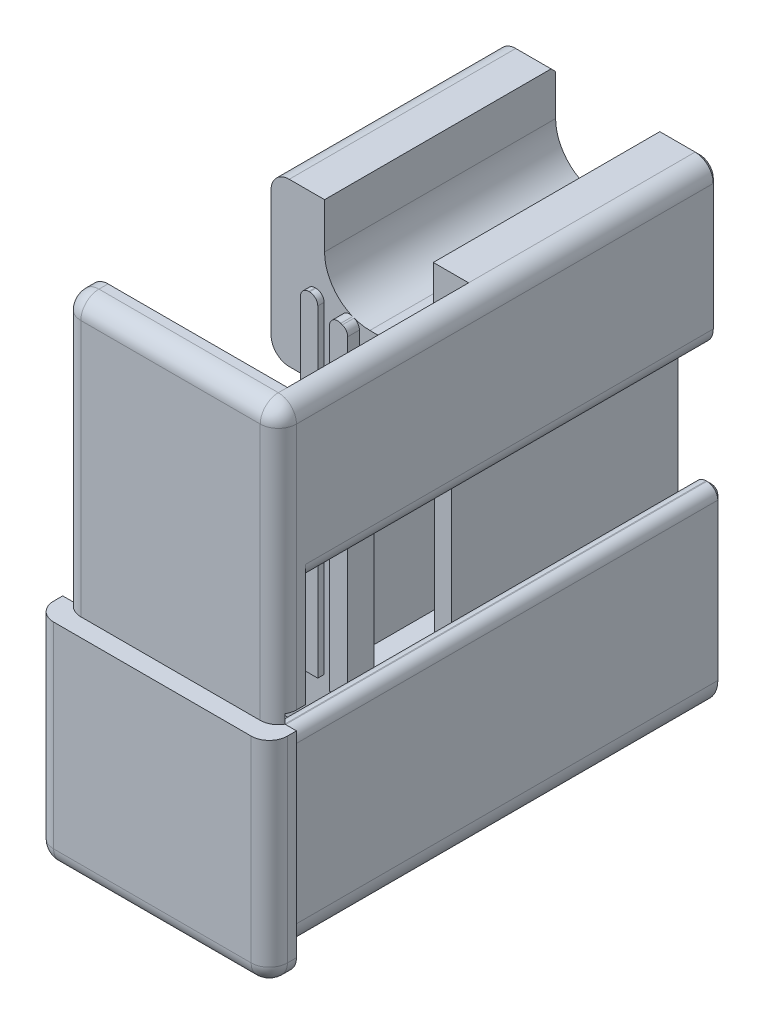
from build123d import *

# Parameters (mm, degrees)
BOSS_EXTRUDE1_DEPTH  = 47.5
CHAMFER1_SIZE        = 3
CUT_EXTRUDE1_DEPTH   = 25.5
BOSS_EXTRUDE3_DEPTH  = 47.5
CUT_EXTRUDE3_DEPTH   = 4.3
SKETCH9_R            = 0.7500000000000007
SKETCH9_R_2          = 0.7499999999999999
CUT_EXTRUDE4_DEPTH   = 6
SKETCH10_R           = 2.740000000000001
CUT_EXTRUDE5_DEPTH   = 4.3
FILLET3_R            = 3
SKETCH12_W           = 12.3
SKETCH12_H           = 11.91
BOSS_EXTRUDE4_DEPTH  = 22
CUT_EXTRUDE15_REACH  = 60.816
BOSS_EXTRUDE12_DEPTH = 3
BOSS_EXTRUDE14_DEPTH = 1.6
BOSS_EXTRUDE17_DEPTH = 17.91
CUT_EXTRUDE16_DEPTH  = 68.03823983369492
SKETCH46_W           = 12.300000000000002
SKETCH46_H           = 4.5
CUT_EXTRUDE18_DEPTH  = 64.86169117710554
SKETCH47_R           = 2.7499999999999996
CUT_EXTRUDE19_DEPTH  = 4.3
SKETCH48_W           = 5.750000000000001
SKETCH48_H           = 17.910000000000004
BOSS_EXTRUDE18_DEPTH = 47.5
BOSS_EXTRUDE19_DEPTH = 1.3
BOSS_EXTRUDE20_DEPTH = 2
SKETCH51_W           = 3.000000000000007
SKETCH51_H           = 29.32
BOSS_EXTRUDE21_DEPTH = 1
SKETCH52_W           = 1.9999999999999973
SKETCH52_H           = 1.9973883587117314
BOSS_EXTRUDE22_DEPTH = 33.59
SKETCH53_W           = 1.4267044630125962
SKETCH53_H           = 3.5699996885908405
CUT_EXTRUDE20_DEPTH  = 76.05104929313114
SKETCH54_W           = 0.49999999999999645
SKETCH54_H           = 3.000000000000007
BOSS_EXTRUDE23_DEPTH = 29.32
BOSS_EXTRUDE24_DEPTH = 54
CUT_EXTRUDE21_DEPTH  = 51.5
SKETCH60_W           = 21.8
SKETCH60_H           = 29.320000000000004
BOSS_EXTRUDE27_DEPTH = 2
CUT_EXTRUDE22_DEPTH  = 5
FILLET6_START        = -1
FILLET6_DEPTH        = 52
FILLET6_START_2      = 45.5
FILLET6_2_DEPTH      = 5.5
FILLET7_R            = 2
CHAMFER2_SIZE        = 0.5
BOSS_EXTRUDE28_DEPTH = 0.7
FILLET9_R            = 0.9
BOSS_EXTRUDE29_DEPTH = 33.59
FILLET10_R           = 0.9
CUT_EXTRUDE23_REACH  = 72.305
FILLET11_R           = 2
SKETCH68_W           = 12
SKETCH68_H           = 10.370358528616812
CUT_EXTRUDE24_DEPTH  = 35
FILLET12_R           = 5
FILLET13_R           = 0.9


with BuildPart() as part:
    # Sketch2 → Boss-Extrude1 (new body)
    with BuildSketch(Plane.XY):
        with BuildLine():
            Line((-9.899999999999999, 10.14), (-9.9, 8.34))
            Line((-9.9, 8.34), (9.899999999999997, 8.34))
            Line((9.899999999999997, 8.34), (9.899999999999997, 10.14))
            ThreePointArc((9.899999999999997, 10.14), (10.25147186257614, 10.988528137423858), (11.099999999999998, 11.340000000000002))
            Line((11.099999999999998, 11.340000000000002), (11.2, 11.340000000000002))
            ThreePointArc((11.2, 11.340000000000002), (12.048528137423856, 10.988528137423858), (12.4, 10.14))
            Line((12.4, 10.14), (12.400000000000004, -11.339999999999998))
            Line((12.400000000000004, -11.339999999999998), (-12.399999999999997, -11.339999999999998))
            Line((-12.399999999999997, -11.339999999999998), (-12.399999999999999, 10.140000000000002))
            ThreePointArc((-12.399999999999999, 10.140000000000002), (-12.048528137423855, 10.98852813742386), (-11.199999999999998, 11.340000000000003))
            Line((-11.199999999999998, 11.340000000000003), (-11.099999999999998, 11.340000000000002))
            ThreePointArc((-11.099999999999998, 11.340000000000002), (-10.25147186257614, 10.988528137423858), (-9.899999999999999, 10.14))
        make_face()
    extrude(amount=BOSS_EXTRUDE1_DEPTH)

    # Chamfer1
    chamfer1_edges = [part.edges().sort_by_distance(p)[0] for p in [
        (12.400000000000004, -11.339999999999998, 23.75),
        (-12.399999999999997, -11.339999999999998, 23.75),
    ]]
    chamfer(chamfer1_edges, length=CHAMFER1_SIZE)

    # Sketch3 → Cut-Extrude1 (cut)
    with BuildSketch(Plane(origin=(0, 0, 0), x_dir=(-1, 0, 0), z_dir=(0, 0, -1))):
        with BuildLine():
            Line((6.15, 20.249999999999996), (-6.15, 20.249999999999996))
            Line((-6.15, 20.249999999999996), (-6.149999999999999, 8.34))
            Line((-6.15, 8.34), (-1.6326971550167642, 8.34))
            ThreePointArc((-1.6326971550167664, 8.340000000000014), (1.3509e-13, 8.57), (1.6326971550170248, 8.339999999999941))
            Line((1.6326971550170342, 8.34), (6.150000000000001, 8.34))
            Line((6.150000000000001, 8.34), (6.1499999999999995, 20.249999999999996))
        make_face()
        with BuildLine():
            Line((-1.6326971550167642, 8.34), (-6.15, 8.34))
            Line((-6.149999999999999, 8.34), (-6.149999999999998, -3.25))
            Line((-6.149999999999998, -3.2499999999999996), (1.267822913e-08, -3.2499999999999996))
            ThreePointArc((1.267822901e-08, -3.249999999999999), (-5.852217527540324, 1.8355911145858417), (-1.6326971550167664, 8.340000000000014))
        make_face()
        with BuildLine():
            Line((6.150000000000003, -3.25), (6.150000000000001, 8.34))
            Line((6.150000000000001, 8.34), (1.6326971550170342, 8.34))
            ThreePointArc((1.6326971550170248, 8.339999999999941), (4.721087808236075, 6.215197590419512), (5.910000000000001, 2.660000000000001))
            ThreePointArc((5.910000000000001, 2.6599999999999997), (4.179001081294925, -1.5190010723300666), (1.267822901e-08, -3.249999999999999))
            Line((1.267822913e-08, -3.2499999999999996), (6.150000000000003, -3.2499999999999996))
        make_face()
        with BuildLine():
            Line((1.6326971550170342, 8.34), (-1.6326971550167642, 8.34))
            ThreePointArc((-1.6326971550167664, 8.340000000000014), (-5.852217527540324, 1.8355911145858417), (1.267822901e-08, -3.249999999999999))
            ThreePointArc((1.267822901e-08, -3.249999999999999), (4.179001081294925, -1.5190010723300666), (5.910000000000001, 2.6599999999999997))
            ThreePointArc((5.910000000000001, 2.660000000000001), (4.721087808236075, 6.215197590419512), (1.6326971550170248, 8.339999999999941))
        make_face()
        with BuildLine():
            ThreePointArc((1.6326971550170248, 8.339999999999941), (1.3509e-13, 8.57), (-1.6326971550167664, 8.340000000000014))
            Line((-1.6326971550167642, 8.34), (1.6326971550170342, 8.34))
        make_face()
    extrude(amount=-CUT_EXTRUDE1_DEPTH, mode=Mode.SUBTRACT)

    # Sketch6 → Boss-Extrude3 (add)
    with BuildSketch(Plane(origin=(0, 0, 0), x_dir=(-1, 0, 0), z_dir=(0, 0, -1))):
        Polygon((-6.149999999999999, 8.34), (-6.149999999999999, 20.25), (6.1499999999999995, 20.25), (6.150000000000002, 8.34), (8.025, 8.34), (8.025, 24.25), (-8.024999999999997, 24.249999999999996), (-8.024999999999997, 8.34), align=None)
    extrude(amount=-BOSS_EXTRUDE3_DEPTH)

    # Sketch8 → Cut-Extrude3 (cut)
    with BuildSketch(Plane(origin=(0, 0, 0), x_dir=(-1, 0, 0), z_dir=(0, 0, -1))):
        Polygon((-6.150000000000003, 24.750000000000004), (6.1499999999999995, 24.750000000000004), (6.150000000000004, -7.7499999999999964), (-6.1499999999999995, -7.7499999999999964), align=None)
    extrude(amount=-CUT_EXTRUDE3_DEPTH, mode=Mode.SUBTRACT)

    # Sketch9 → Cut-Extrude4 (cut)
    with BuildSketch(Plane(origin=(0, 0, 4.3), x_dir=(-1, 0, 0), z_dir=(0, 0, -1))):
        with Locations((0, 22.75)):
            Circle(SKETCH9_R)
        with Locations((4.7e-16, -5.749999999999998)):
            Circle(SKETCH9_R_2)
    extrude(amount=-CUT_EXTRUDE4_DEPTH, mode=Mode.SUBTRACT)

    # Sketch10 → Cut-Extrude5 (cut)
    with BuildSketch(Plane(origin=(0, 0, 0), x_dir=(-1, 0, 0), z_dir=(0, 0, -1))):
        with Locations((4.7e-16, -5.749999999999998)):
            Circle(SKETCH10_R)
    extrude(amount=-CUT_EXTRUDE5_DEPTH, mode=Mode.SUBTRACT)

    # Fillet3
    fillet3_edges = [part.edges().sort_by_distance(p)[0] for p in [
        (12.400000000000004, -8.339999999999996, 23.75),
        (-9.399999999999997, -11.339999999999998, 23.75),
        (9.400000000000004, -11.339999999999996, 23.75),
        (-12.399999999999997, -8.339999999999998, 23.75),
    ]]
    fillet(fillet3_edges, radius=FILLET3_R)

    # Sketch12 → Boss-Extrude4 (add)
    with BuildSketch(Plane.XY.offset(47.5)):
        with Locations((1.33e-15, 14.295)):
            Rectangle(SKETCH12_W, SKETCH12_H)
    extrude(amount=-BOSS_EXTRUDE4_DEPTH)

    # Cut-Extrude15: up to this face of the body (flat: up to its plane)
    cut_extrude15_end = Plane(part.part.faces().sort_by_distance((6.15, 8.445894936, 12.140641711))[0])
    # Sketch38 → Cut-Extrude15 (cut, up to the picked face)
    with BuildSketch(Plane.ZY.offset(12.399999999999999), mode=Mode.PRIVATE) as cut_extrude15_sk1:
        Polygon((25.5, 27.009269864350156), (45.5, 27.009269864350156), (45.50000000000001, -9.339999999999995), (25.500000000000004, -9.339999999999998), align=None)
    cut_extrude15_tool1 = split(extrude(cut_extrude15_sk1.sketch, amount=-CUT_EXTRUDE15_REACH, mode=Mode.PRIVATE), bisect_by=cut_extrude15_end, keep=Keep.BOTH, mode=Mode.PRIVATE)
    add(cut_extrude15_tool1.solids().sort_by(Axis((-12.4, 8.834635, 35.5), (1, 8e-17, 0)))[0], mode=Mode.SUBTRACT)

    # Sketch39 → Boss-Extrude12 (add)
    with BuildSketch(Plane.XY.offset(47.5)):
        Polygon((-11.899999999999993, 42.160000000000004), (11.900000000000004, 42.160000000000004), (11.900000000000004, 12.84), (12.90000000000001, 12.84), (12.900000000000013, -11.839999999999998), (-12.899999999999991, -11.839999999999998), (-12.899999999999999, 12.84), (-11.899999999999997, 12.84), align=None)
    extrude(amount=BOSS_EXTRUDE12_DEPTH)

    # Sketch40 → Boss-Extrude14 (add)
    with BuildSketch(Plane.XY.offset(25.500000000000004)):
        Polygon((-6.150000000000001, 24.249999999999996), (-2.1500000000000044, 24.249999999999996), (-2.149999999999999, -9.34), (-6.150000000000001, -9.340000000000002), align=None)
    extrude(amount=-BOSS_EXTRUDE14_DEPTH)

    # Sketch44 → Boss-Extrude17 (add)
    with BuildSketch(Plane(origin=(5.24e-15, 24.249999999999996, 0), x_dir=(1, -2.2e-16, 0), z_dir=(2.2e-16, 1, 0))):
        Polygon((-12.900000000000002, -4.3), (-12.900000000000002, -25.5), (12.900000000000006, -25.5), (12.900000000000006, -4.3), (12.900000000000006, 0), (8.024999999999993, 0), (-8.025000000000006, 0), (-12.900000000000002, 0), align=None)
    extrude(amount=BOSS_EXTRUDE17_DEPTH)

    # Sketch45 → Cut-Extrude16 (cut, through all)
    with BuildSketch(Plane.XY.offset(50.5)):
        Polygon((-16.269031670348404, 12.84), (-11.899999999999997, 12.84), (-11.899999999999997, 45.382940097126145), (11.900000000000004, 45.382940097126145), (11.900000000000004, 12.84), (18.903796539654053, 12.84), (18.903796539654053, 57.76860653738656), (-16.269031670348404, 57.76860653738656), align=None)
    extrude(amount=-CUT_EXTRUDE16_DEPTH, mode=Mode.SUBTRACT)

    # Sketch46 → Cut-Extrude18 (cut, through all)
    with BuildSketch(Plane(origin=(0, 0, 4.3), x_dir=(-1, 0, 0), z_dir=(0, 0, -1))):
        with Locations((-8.9e-16, 22.5)):
            Rectangle(SKETCH46_W, SKETCH46_H)
    extrude(amount=CUT_EXTRUDE18_DEPTH, mode=Mode.SUBTRACT)

    # Sketch47 → Cut-Extrude19 (cut)
    with BuildSketch(Plane(origin=(0, 0, 0), x_dir=(-1, 0, 0), z_dir=(0, 0, -1))):
        with Locations((0, 22.75)):
            Circle(SKETCH47_R)
    extrude(amount=-CUT_EXTRUDE19_DEPTH, mode=Mode.SUBTRACT)

    # Sketch48 → Boss-Extrude18 (add)
    with BuildSketch(Plane(origin=(0, 0, 0), x_dir=(-1, 0, 0), z_dir=(0, 0, -1))):
        with Locations((-9.025000000000004, 33.205)):
            Rectangle(SKETCH48_W, SKETCH48_H)
    extrude(amount=-BOSS_EXTRUDE18_DEPTH)

    # Sketch49 → Boss-Extrude19 (add)
    with BuildSketch(Plane.XY.offset(25.500000000000004)):
        Polygon((-2.150000000000003, -3.250000000000002), (-4.150000000000003, -3.2500000000000027), (-4.150000000000003, 33.21655266597588), (-2.150000000000003, 33.21655266597588), align=None)
    extrude(amount=BOSS_EXTRUDE19_DEPTH)

    # Sketch50 → Boss-Extrude20 (add)
    with BuildSketch(Plane(origin=(0, 0, 47.5), x_dir=(-1, 0, 0), z_dir=(0, 0, -1))):
        Polygon((11.899999999999993, 42.160000000000004), (9.899999999999993, 42.160000000000004), (9.899999999999997, 12.84), (11.899999999999993, 12.84), align=None)
    extrude(amount=BOSS_EXTRUDE20_DEPTH)

    # Sketch51 → Boss-Extrude21 (add)
    with BuildSketch(Plane.ZY.offset(11.899999999999999)):
        with Locations((49, 27.500000000000004)):
            Rectangle(SKETCH51_W, SKETCH51_H)
    extrude(amount=BOSS_EXTRUDE21_DEPTH)

    # Sketch52 → Boss-Extrude22 (add)
    with BuildSketch(Plane(origin=(5.24e-15, 24.249999999999996, 0), x_dir=(1, -2.2e-16, 0), z_dir=(2.2e-16, 1, 0))):
        with Locations((-3.1500000000000097, -44.50130582064414)):
            Rectangle(SKETCH52_W, SKETCH52_H)
    extrude(amount=-BOSS_EXTRUDE22_DEPTH)

    # Sketch53 → Cut-Extrude20 (cut, through all)
    with BuildSketch(Plane(origin=(0, 42.160000000000004, 0), x_dir=(1, 0, 0), z_dir=(0, 1, 0))):
        with Locations((13.113352231506298, -49.28499984429542)):
            Rectangle(SKETCH53_W, SKETCH53_H)
    extrude(amount=-CUT_EXTRUDE20_DEPTH, mode=Mode.SUBTRACT)

    # Sketch54 → Boss-Extrude23 (add)
    with BuildSketch(Plane(origin=(0, 42.160000000000004, 0), x_dir=(1, 0, 0), z_dir=(0, 1, 0))):
        with Locations((12.150000000000002, -49)):
            Rectangle(SKETCH54_W, SKETCH54_H)
    extrude(amount=-BOSS_EXTRUDE23_DEPTH)

    # Sketch56 → Boss-Extrude24 (add)
    with BuildSketch(Plane(origin=(0, 42.160000000000004, 0), x_dir=(1, 0, 0), z_dir=(0, 1, 0))):
        Polygon((11.900000000000004, -47.5), (12.900000000000007, -47.5), (12.900000000000006, -50.5), (11.900000000000004, -50.5), align=None)
    extrude(amount=-BOSS_EXTRUDE24_DEPTH)

    # Sketch57 → Cut-Extrude21 (cut)
    with BuildSketch(Plane(origin=(0, 42.160000000000004, 0), x_dir=(1, 0, 0), z_dir=(0, 1, 0))):
        Polygon((6.150000000000003, -25.5), (9.900000000000004, -25.5), (9.900000000000006, -45.50000000000001), (6.150000000000003, -45.50000000000001), align=None)
    extrude(amount=-CUT_EXTRUDE21_DEPTH, mode=Mode.SUBTRACT)

    # Sketch60 → Boss-Extrude27 (add)
    with BuildSketch(Plane(origin=(0, 8.69e-15, 45.50000000000001), x_dir=(-1, 0, 0), z_dir=(0, -1.9e-16, -1))):
        with Locations((-1.0000000000000036, 27.499999999999993)):
            Rectangle(SKETCH60_W, SKETCH60_H)
    extrude(amount=-BOSS_EXTRUDE27_DEPTH)

    # Sketch61 → Cut-Extrude22 (cut)
    with BuildSketch(Plane(origin=(0, 8.69e-15, 45.50000000000001), x_dir=(-1, 0, 0), z_dir=(0, -1.9e-16, -1))):
        Polygon((-11.900000000000004, 12.839999999999993), (-11.900000000000004, 11.839999999999993), (-20.816988855044816, 11.839999999999993), (-20.816988855044816, 12.76659742079938), (-20.816988855044816, 43.24652962727814), (-11.900000000000004, 43.24652962727814), align=None)
        Polygon((11.899999999999997, 12.839999999999993), (11.899999999999997, 44.22783329067296), (16.70735653112443, 44.22783329067296), (16.70735653112443, 12.766597420799354), (16.70735653112443, 11.840000000000002), (11.899999999999997, 11.840000000000002), align=None)
    extrude(amount=-CUT_EXTRUDE22_DEPTH, mode=Mode.SUBTRACT)

    # Fillet6: read off the stored shape, not the designer's step
    # Fillet6 outline → Fillet6 (cut)
    with BuildSketch(Plane.XY.offset(FILLET6_START)):
        with BuildLine():
            Line((11.9, 42.16), (9.9, 42.16))
            ThreePointArc((9.9, 42.16), (11.314213562, 41.574213562), (11.9, 40.16))
            Line((11.9, 40.16), (11.9, 42.16))
        make_face()
        with BuildLine():
            Line((12.9, -11.84), (12.9, -9.84))
            ThreePointArc((12.9, -9.84), (12.314213562, -11.254213562), (10.9, -11.84))
            Line((10.9, -11.84), (12.9, -11.84))
        make_face()
        with BuildLine():
            Line((-12.9, -11.84), (-10.9, -11.84))
            ThreePointArc((-10.9, -11.84), (-12.314213562, -11.254213562), (-12.9, -9.84))
            Line((-12.9, -9.84), (-12.9, -11.84))
        make_face()
    extrude(amount=FILLET6_DEPTH, mode=Mode.SUBTRACT)

    # Fillet6 2 outline → Fillet6 2 (cut)
    with BuildSketch(Plane.XY.offset(FILLET6_START_2)):
        with BuildLine():
            Line((-11.9, 42.16), (-11.9, 40.16))
            ThreePointArc((-11.9, 40.16), (-11.314213562, 41.574213562), (-9.9, 42.16))
            Line((-9.9, 42.16), (-11.9, 42.16))
        make_face()
    extrude(amount=FILLET6_2_DEPTH, mode=Mode.SUBTRACT)

    # Fillet7
    fillet7_edges = [part.edges().sort_by_distance(p)[0] for p in [
        (-11.899999999999997, 42.16, 12.75),
        (-11.899999999999997, 24.25, 12.75),
        (11.900000000000004, 24.249999999999996, 22.750000000000004),
    ]]
    fillet(fillet7_edges, radius=FILLET7_R)

    # Chamfer2
    chamfer2_edges = [part.edges().sort_by_distance(p)[0] for p in [
        (4.011429388688709, -7.7499999999999964, 0),
        (-12.399999999999999, 1.521320343559644, 0),
        (-12.048528137423855, 10.98852813742386, 0),
        (-11.149999999999999, 11.340000000000003, 0),
        (-4.011429388688847, -7.7499999999999964, 0),
        (-10.25147186257614, 10.988528137423858, 0),
        (-1.4112e-13, -8.489999999999998, 0),
        (-9.899999999999999, 9.24, 0),
        (8.962499999999997, 8.34, 0),
        (9.899999999999997, 9.24, 0),
        (12.400000000000002, 1.5213203435596458, 0),
        (10.900000000000002, -9.839999999999995, 0),
        (3.55e-15, -11.339999999999998, 0),
        (-10.899999999999995, -9.84, 0),
        (-12.171638597533859, -8.245409609975983, 0),
        (10.25147186257614, 10.988528137423858, 0),
        (-9.305409609975978, -11.111638597533858, 0),
        (9.305409609975985, -11.111638597533856, 0),
        (12.171638597533864, -8.245409609975978, 0),
        (11.149999999999999, 11.340000000000002, 0),
        (12.048528137423856, 10.988528137423858, 0),
        (-8.9625, 24.25, 0),
        (-4.018729304408881, 24.75, 0),
        (4.018729304408868, 24.75, 0),
        (-1.36e-14, 25.5, 0),
        (-6.150000000000002, 8.5, 0),
        (6.15, 8.5, 0),
        (-8.9625, 8.34, 0),
        (-8.025, 16.295, 0),
        (8.024999999999997, 16.294999999999998, 0),
        (11.900000000000004, 33.205, 0),
        (11.314213562, 41.574213562, 0),
        (-11.899999999999997, 33.205000000000005, 0),
        (1.78e-15, 42.16, 0),
        (8.9625, 24.249999999999993, 0),
        (-11.31421356237309, 41.574213562373096, 0),
        (11.3142135623731, 24.835786437626897, 2.1e-16),
        (-11.314213562373093, 24.835786437626904, 0),
    ]]
    chamfer(chamfer2_edges, length=CHAMFER2_SIZE)

    # Sketch64 → Boss-Extrude28 (add)
    with BuildSketch(Plane.XY.offset(25.500000000000004)):
        Polygon((-6.050000000000003, 33.21655266597588), (-7.950000000000002, 33.21655266597588), (-7.949999999999997, -3.250000000000003), (-6.049999999999998, -3.250000000000003), align=None)
    extrude(amount=BOSS_EXTRUDE28_DEPTH)

    # Fillet9
    fillet9_edges = [part.edges().sort_by_distance(p)[0] for p in [
        (-2.150000000000003, 33.21655266597588, 26.150000000000002),
        (-4.150000000000003, 33.21655266597588, 26.150000000000002),
        (-2.1500000000000057, 24.249999999999996, 44.50130582064414),
        (-4.150000000000003, 24.249999999999996, 44.50130582064414),
        (-6.050000000000003, 33.21655266597588, 25.850000000000005),
        (-7.950000000000002, 33.21655266597588, 25.850000000000005),
    ]]
    fillet(fillet9_edges, radius=FILLET9_R)

    # Sketch65 → Boss-Extrude29 (add)
    with BuildSketch(Plane(origin=(5.24e-15, 24.249999999999996, 0), x_dir=(1, -2.2e-16, 0), z_dir=(2.2e-16, 1, 0))):
        Polygon((-6.050000000000009, -45.5), (-7.950000000000009, -45.5), (-7.950000000000009, -44.8), (-6.050000000000008, -44.79999999999999), align=None)
    extrude(amount=-BOSS_EXTRUDE29_DEPTH)

    # Fillet10
    fillet10_edges = [part.edges().sort_by_distance(p)[0] for p in [
        (-6.0500000000000025, 24.249999999999996, 45.14999999999999),
        (-7.950000000000004, 24.249999999999996, 45.15),
    ]]
    fillet(fillet10_edges, radius=FILLET10_R)

    # Cut-Extrude23: up to this face of the body (flat: up to its plane)
    cut_extrude23_end = Plane(part.part.faces().sort_by_distance((-11.9, 26.195702006, 48.021489971))[0])
    # Sketch67 → Cut-Extrude23 (cut, up to the picked face)
    with BuildSketch(Plane(origin=(11.900000000000004, 0, 0), x_dir=(0, 0, -1), z_dir=(1, 0, 0)), mode=Mode.PRIVATE) as cut_extrude23_sk1:
        Polygon((-50.5, 42.160000000000004), (-48.5, 42.160000000000004), (-48.49999999999999, 11.840000000000003), (-50.5, 11.840000000000003), align=None)
    cut_extrude23_tool1 = split(extrude(cut_extrude23_sk1.sketch, amount=-CUT_EXTRUDE23_REACH, mode=Mode.PRIVATE), bisect_by=cut_extrude23_end, keep=Keep.BOTH, mode=Mode.PRIVATE)
    add(cut_extrude23_tool1.solids().sort_by(Axis((11.9, 27, 49.5), (-1, 0, 0)))[0], mode=Mode.SUBTRACT)

    # Fillet11
    # the kernel refuses this fillet: 2 mm, written as the material it takes off along each edge
    with BuildSketch(Plane(origin=(12.900000000000006, 16.840000000000003, 50.5), x_dir=(8.9e-16, 0, -1), z_dir=(0, -1, 0))) as fillet11_piece_1:
        with BuildLine():
            CenterArc((FILLET11_R, -FILLET11_R), FILLET11_R, 89.99999999999994, 90)
            Line((-1.78e-15, -FILLET11_R), (0, 0))
            Line((0, 0), (FILLET11_R, 0))
        make_face()
    extrude(amount=26.68, mode=Mode.SUBTRACT)
    with BuildSketch(Plane(origin=(10.899999998726177, -9.839999998726174, 50.5), x_dir=(1.0, -6.36912744361302e-10, 0), z_dir=(6.36912744361302e-10, 1.0, 0))) as fillet11_piece_2:
        with BuildLine():
            CenterArc((2.0000000012738255 - FILLET11_R, FILLET11_R), FILLET11_R, 270, 90)
            Line((2.0000000012738255 - FILLET11_R, 0), (2.0000000012738255, 0))
            Line((2.0000000012738255, 0), (2.0000000012738255, FILLET11_R))
        make_face()
    revolve(axis=Axis((10.899999998726177, -9.839999998726174, 50.5), (0, 0, -1)), revolution_arc=89.99999992701522, mode=Mode.SUBTRACT)
    with BuildSketch(Plane(origin=(-10.9, -11.839999999999998, 50.5), x_dir=(0, 0, -1), z_dir=(1, 7e-17, 0))) as fillet11_piece_3:
        with BuildLine():
            CenterArc((FILLET11_R, FILLET11_R), FILLET11_R, 180, 90)
            Line((0, FILLET11_R), (0, 0))
            Line((0, 0), (FILLET11_R, 0))
        make_face()
    extrude(amount=21.799999999999997, mode=Mode.SUBTRACT)
    with BuildSketch(Plane(origin=(-10.899999998726177, -9.839999998726174, 50.5), x_dir=(-6.369118561828829e-10, -1.0, 0), z_dir=(1.0, -6.369118561828829e-10, 0))) as fillet11_piece_4:
        with BuildLine():
            CenterArc((2.0000000012738255 - FILLET11_R, FILLET11_R), FILLET11_R, 270, 90)
            Line((2.0000000012738255 - FILLET11_R, 0), (2.0000000012738255, 0))
            Line((2.0000000012738255, 0), (2.0000000012738255, FILLET11_R))
        make_face()
    revolve(axis=Axis((-10.899999998726177, -9.839999998726174, 50.5), (0, 0, -1)), revolution_arc=89.99999992701522, mode=Mode.SUBTRACT)
    with BuildSketch(Plane(origin=(11.900000000000004, 40.16, 48.5), x_dir=(-1, 0, 0), z_dir=(0, -1, -2.3e-16))) as fillet11_piece_5:
        with BuildLine():
            CenterArc((FILLET11_R, FILLET11_R), FILLET11_R, 180, 90)
            Line((0, FILLET11_R), (0, 0))
            Line((0, 0), (FILLET11_R, 0))
        make_face()
    extrude(amount=28.319999999999993, mode=Mode.SUBTRACT)
    with BuildSketch(Plane(origin=(9.899999998726177, 40.15999999872617, 48.5), x_dir=(6.369118561828829e-10, 1.0, 0), z_dir=(-1.0, 6.369118561828829e-10, 0))) as fillet11_piece_6:
        with BuildLine():
            CenterArc((2.0000000012738255 - FILLET11_R, FILLET11_R), FILLET11_R, 270, 90)
            Line((2.0000000012738255 - FILLET11_R, 0), (2.0000000012738255, 0))
            Line((2.0000000012738255, 0), (2.0000000012738255, FILLET11_R))
        make_face()
    revolve(axis=Axis((9.899999998726177, 40.15999999872617, 48.5), (0, 0, -1)), revolution_arc=89.99999992701522, mode=Mode.SUBTRACT)
    with BuildSketch(Plane(origin=(9.9, 42.160000000000004, 48.5), x_dir=(0, -1, 0), z_dir=(-1, 0, 0))) as fillet11_piece_7:
        with BuildLine():
            CenterArc((FILLET11_R, -FILLET11_R), FILLET11_R, 90, 90)
            Line((0, -FILLET11_R), (0, 0))
            Line((0, 0), (FILLET11_R, 0))
        make_face()
    extrude(amount=19.8, mode=Mode.SUBTRACT)
    with BuildSketch(Plane(origin=(-9.899999998726177, 40.15999999872617, 48.5), x_dir=(-1.0, 6.36912744361302e-10, 0), z_dir=(-6.36912744361302e-10, -1.0, 0))) as fillet11_piece_8:
        with BuildLine():
            CenterArc((2.0000000012738255 - FILLET11_R, FILLET11_R), FILLET11_R, 270, 90)
            Line((2.0000000012738255, FILLET11_R), (2.0000000012738255, 0))
            Line((2.0000000012738255, 0), (2.0000000012738255 - FILLET11_R, 0))
        make_face()
    revolve(axis=Axis((-9.899999998726177, 40.15999999872617, 48.5), (0, 0, -1)), revolution_arc=89.99999992701522, mode=Mode.SUBTRACT)
    with BuildSketch(Plane(origin=(-12.899999999999993, 16.84000000000001, 50.5), x_dir=(1, 3e-17, 0), z_dir=(3e-17, -1, 0))) as fillet11_piece_9:
        with BuildLine():
            CenterArc((FILLET11_R, -FILLET11_R), FILLET11_R, 90, 90)
            Line((0, -FILLET11_R), (0, 0))
            Line((0, 0), (FILLET11_R, 0))
        make_face()
    extrude(amount=26.680000000000007, mode=Mode.SUBTRACT)
    with BuildSketch(Plane(origin=(-11.899999999999997, 40.16, 48.5), x_dir=(1, 0, -3.55e-15), z_dir=(0, -1, -2.3e-16))) as fillet11_piece_10:
        with BuildLine():
            CenterArc((FILLET11_R, -FILLET11_R), FILLET11_R, 90.0000000000002, 89.9999999999996)
            Line((7.11e-15, -FILLET11_R), (0, 0))
            Line((0, 0), (FILLET11_R, 0))
        make_face()
    extrude(amount=28.319999999999993, mode=Mode.SUBTRACT)

    # Sketch68 → Cut-Extrude24 (cut)
    with BuildSketch(Plane(origin=(0, 0, 0), x_dir=(-1, 0, 0), z_dir=(0, 0, -1))):
        with Locations((0, 37.34517926430841)):
            Rectangle(SKETCH68_W, SKETCH68_H)
    extrude(amount=-CUT_EXTRUDE24_DEPTH, mode=Mode.SUBTRACT)

    # Fillet12
    # the kernel refuses this fillet: 5 mm, written as the material it adds along each edge
    with BuildSketch(Plane(origin=(-6, 32.160000000000004, 0), x_dir=(0, 1, 0), z_dir=(0, 0, 1))) as fillet12_piece_1_section:
        with BuildLine():
            CenterArc((FILLET12_R, -FILLET12_R), FILLET12_R, 90, 90)
            Line((0, -FILLET12_R), (0, 0))
            Line((0, 0), (FILLET12_R, 0))
        make_face()
    fillet12_piece_1 = extrude(amount=25.5, mode=Mode.PRIVATE)
    fillet12_piece_1 = split(fillet12_piece_1, bisect_by=Plane(origin=(-4.150000000000003, 32.160000000000004, 0), z_dir=(-1, 0, 0)), keep=Keep.TOP, mode=Mode.PRIVATE)
    add(fillet12_piece_1)
    with BuildSketch(Plane(origin=(-6, 32.160000000000004, 0), x_dir=(0, 1, 0), z_dir=(0, 0, 1))) as fillet12_piece_2_section:
        with BuildLine():
            CenterArc((FILLET12_R, -FILLET12_R), FILLET12_R, 90, 90)
            Line((0, -FILLET12_R), (0, 0))
            Line((0, 0), (FILLET12_R, 0))
        make_face()
    fillet12_piece_2 = extrude(amount=25.5, mode=Mode.PRIVATE)
    fillet12_piece_2 = split(fillet12_piece_2, bisect_by=Plane(origin=(-4.150000000000003, 32.160000000000004, 0), z_dir=(1, 0, 0)), keep=Keep.TOP, mode=Mode.PRIVATE)
    fillet12_piece_2 = split(fillet12_piece_2, bisect_by=Plane(origin=(-2.150000000000003, 32.160000000000004, 0), z_dir=(-1, 0, 0)), keep=Keep.TOP, mode=Mode.PRIVATE)
    add(fillet12_piece_2)
    with BuildSketch(Plane(origin=(-6, 32.160000000000004, 0), x_dir=(0, 1, 0), z_dir=(0, 0, 1))) as fillet12_piece_3_section:
        with BuildLine():
            CenterArc((FILLET12_R, -FILLET12_R), FILLET12_R, 90, 90)
            Line((0, -FILLET12_R), (0, 0))
            Line((0, 0), (FILLET12_R, 0))
        make_face()
    fillet12_piece_3 = extrude(amount=25.5, mode=Mode.PRIVATE)
    fillet12_piece_3 = split(fillet12_piece_3, bisect_by=Plane(origin=(-2.150000000000003, 32.160000000000004, 0), z_dir=(1, 0, 0)), keep=Keep.TOP, mode=Mode.PRIVATE)
    add(fillet12_piece_3)
    with BuildSketch(Plane(origin=(-6, 32.160000000000004, 0), x_dir=(0, 1, 0), z_dir=(0, 0, 1))) as fillet12_piece_4_section:
        with BuildLine():
            CenterArc((FILLET12_R, -FILLET12_R), FILLET12_R, 90, 90)
            Line((0, -FILLET12_R), (0, 0))
            Line((0, 0), (FILLET12_R, 0))
        make_face()
    fillet12_piece_4 = extrude(amount=38, mode=Mode.PRIVATE)
    fillet12_piece_4 = split(fillet12_piece_4, bisect_by=Plane(origin=(-6, 32.160000000000004, 25.5), z_dir=(0, 0, 1)), keep=Keep.TOP, mode=Mode.PRIVATE)
    fillet12_piece_4 = split(fillet12_piece_4, bisect_by=Plane(origin=(-4.150000000000003, 32.160000000000004, 0), z_dir=(1, 0, 0)), keep=Keep.TOP, mode=Mode.PRIVATE)
    fillet12_piece_4 = split(fillet12_piece_4, bisect_by=Plane(origin=(-6, 32.160000000000004, 26.800000000000004), z_dir=(0, 0, -1)), keep=Keep.TOP, mode=Mode.PRIVATE)
    fillet12_piece_4 = split(fillet12_piece_4, bisect_by=Plane(origin=(-2.150000000000003, 32.160000000000004, 0), z_dir=(-1, 0, 0)), keep=Keep.TOP, mode=Mode.PRIVATE)
    add(fillet12_piece_4)
    with BuildSketch(Plane(origin=(6, 32.160000000000004, 0), x_dir=(-1, 0, 0), z_dir=(0, 0, 1))) as fillet12_piece_5:
        with BuildLine():
            CenterArc((FILLET12_R, -FILLET12_R), FILLET12_R, 90, 90)
            Line((-8.9e-16, -FILLET12_R), (0, 0))
            Line((0, 0), (FILLET12_R, 0))
        make_face()
    extrude(amount=25.5)

    # Fillet13
    fillet13_edges = [part.edges().sort_by_distance(p)[0] for p in [
        (-2.15, 32.29404685595925, 26.15),
        (-4.15, 33.277024336929216, 26.15),
    ]]
    fillet(fillet13_edges, radius=FILLET13_R)


solid = part.part
